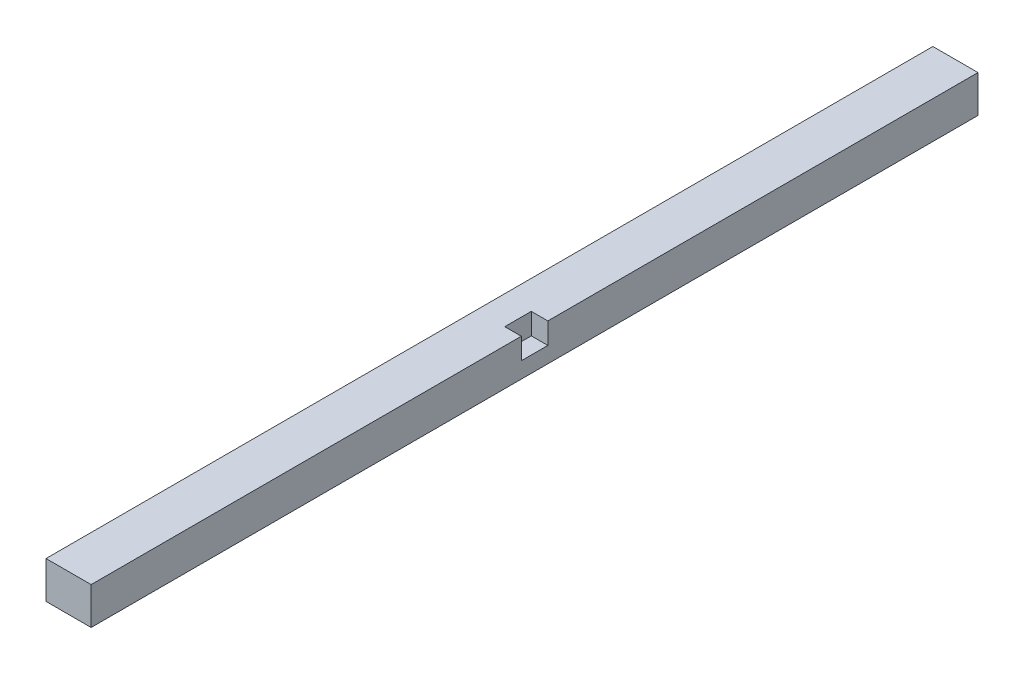
from build123d import *

# Parameters (mm, degrees)
SKETCH1_W              = 4.318
SKETCH1_H              = 84.836
BOSS_EXTRUDE1_DEPTH    = 3.556
CUT_EXTRUDE2_START     = -1.583272769
CUT_EXTRUDE2_OUTLINE_W = 2.54
CUT_EXTRUDE2_OUTLINE_H = 2.032
CUT_EXTRUDE2_DEPTH     = 1.583272769


# Read off the part's stored shape, not the designer's step: Cut-Extrude2
with BuildPart() as part:
    # Sketch1 → Boss-Extrude1 (new body)
    with BuildSketch(Plane(origin=(0, 0, 0), x_dir=(1, 0, 0), z_dir=(0, 1, 0))):
        with Locations((-65.659, 42.418)):
            Rectangle(SKETCH1_W, SKETCH1_H)
    extrude(amount=BOSS_EXTRUDE1_DEPTH)

    # Cut-Extrude2 outline → Cut-Extrude2 (cut)
    with BuildSketch(Plane(origin=(-63.5, 0, 0), x_dir=(0, 0, -1), z_dir=(1, 0, 0)).offset(CUT_EXTRUDE2_START)):
        with Locations((42.418, 2.54)):
            Rectangle(CUT_EXTRUDE2_OUTLINE_W, CUT_EXTRUDE2_OUTLINE_H)
    extrude(amount=CUT_EXTRUDE2_DEPTH, mode=Mode.SUBTRACT)


solid = part.part
